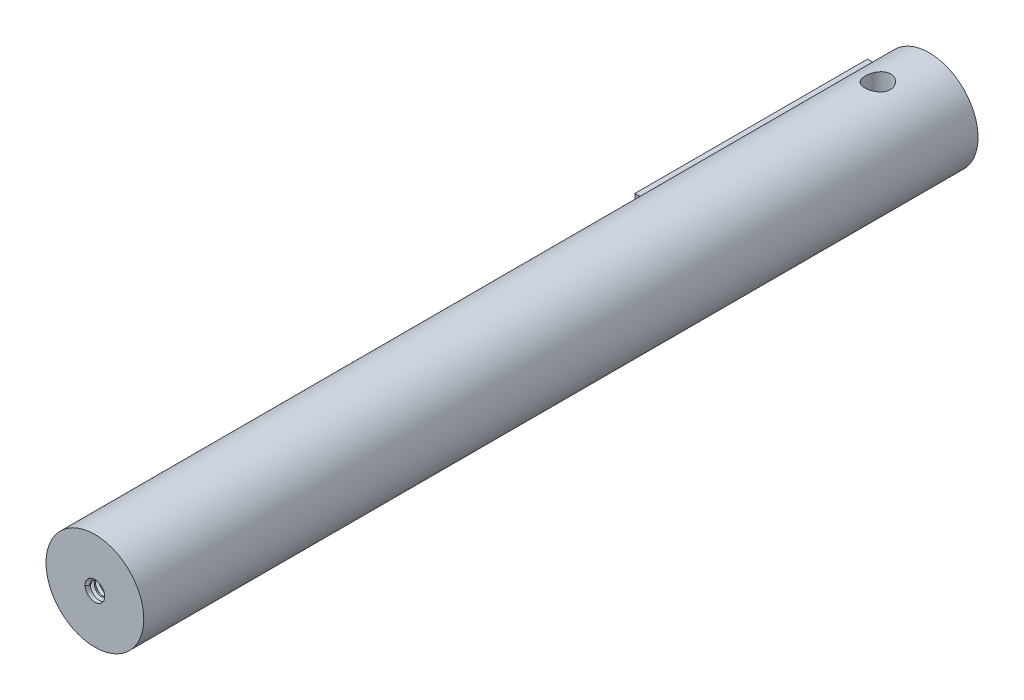
from build123d import *
from build123d.topology import SkipClean

# Parameters (mm, degrees)
BOSS_EXTRUDE4_DEPTH     = 58.928
SKETCH8_R               = 12.3825
BOSS_EXTRUDE5_DEPTH     = 152.4
SKETCH10_R              = 2.487613
CUT_EXTRUDE1_DEPTH      = 12.7
THREAD1_PITCH           = 1.27
CUT_EXTRUDE2_DEPTH      = 213.266198
CUT_EXTRUDE2_DEPTH_BACK = 213.266198
SKETCH11_R              = 3.175


with BuildPart() as part:
    # Sketch1 → Boss-Extrude4 (new body)
    with BuildSketch(Plane.XY):
        with BuildLine():
            Line((0, -2.921), (0, 0))
            Line((0, 0), (0, 3.175))
            Line((0, 3.175), (-11.968529, 3.175))
            ThreePointArc((-11.968529, 3.175), (-12.381807, 0.131032), (-12.033041, -2.921))
            Line((-12.033041, -2.921), (0, -2.921))
        make_face()
        with BuildLine():
            Line((0, 3.175), (0, 0))
            Line((0, 0), (0, -2.921))
            Line((0, -2.921), (-12.033041, -2.921))
            ThreePointArc((-12.033041, -2.921), (1.470915, -12.294825), (12.3825, 0))
            ThreePointArc((12.3825, 0), (1.600937, 12.278571), (-11.968529, 3.175))
            Line((-11.968529, 3.175), (0, 3.175))
        make_face()
        with BuildLine():
            ThreePointArc((-12.033041, -2.921), (-12.381807, 0.131032), (-11.968529, 3.175))
            Line((-11.968529, 3.175), (-15.621, 3.175))
            Line((-15.621, 3.175), (-15.621, -2.921))
            Line((-15.621, -2.921), (-12.033041, -2.921))
        make_face()
    extrude(amount=BOSS_EXTRUDE4_DEPTH)

    # Sketch8 → Boss-Extrude5 (add)
    with BuildSketch(Plane.XY.offset(58.928)):
        with Locations(Location((0, 0, 0), (0, 0, 193.644529))):
            Circle(SKETCH8_R)
    extrude(amount=BOSS_EXTRUDE5_DEPTH)

    # Sketch10 → Cut-Extrude1 (cut)
    with BuildSketch(Plane.XY.offset(211.328)):
        Circle(SKETCH10_R)
    extrude(amount=-CUT_EXTRUDE1_DEPTH, mode=Mode.SUBTRACT)

    # Thread1: the profile of Thread Profile1 profile screwed along a right-hand helix of 10 turns, 8 arcs to a turn; built about Z, then put on its axis
    with SkipClean():  # the faces are left unmerged after this step: merging them gives an invalid solid
        thread1_z = Axis((0, 0, 0), (0, 0, 1))
        thread1_corners = [(2.487913, 0, -0.000173), (2.487913, 0, 1.111423), (1.800205, 0, 0.714375), (1.800205, 0, 0.396875)]
        with BuildLine(mode=Mode.PRIVATE) as thread1_profile:
            Line(thread1_corners[0], thread1_corners[1])
            Line(thread1_corners[1], thread1_corners[2])
            Line(thread1_corners[2], thread1_corners[3])
            Line(thread1_corners[3], thread1_corners[0])
        thread1_cap = Face(thread1_profile.wire())
        thread1_turn_angles = [0, 22.5, 45, 67.5, 90, 112.5, 135, 157.5, 180, 202.5, 225, 247.5, 270, 292.5, 315, 337.5, 360]
        thread1_turn_weights = [1, 0.9238795325112867, 1, 0.9238795325112867, 1, 0.9238795325112867, 1, 0.9238795325112867, 1, 0.9238795325112867, 1, 0.9238795325112867, 1, 0.9238795325112867, 1, 0.9238795325112867, 1]
        thread1_turn_rails = [Edge.make_bspline([Vector(p[0], p[1], 0).rotate(thread1_z, thread1_turn_angles[k]) / thread1_turn_weights[k] + Vector(0, 0, p[2] + THREAD1_PITCH * thread1_turn_angles[k] / 360) for k in range(17)], [0, 0, 0, 1, 1, 2, 2, 3, 3, 4, 4, 5, 5, 6, 6, 7, 7, 8, 8, 8], 2, thread1_turn_weights) for p in thread1_corners]
        thread1_turn_sides = [Face.make_surface_from_curves(thread1_turn_rails[p[0]], thread1_turn_rails[p[1]]) for p in [(0, 1), (1, 2), (2, 3), (3, 0)]]
        thread1 = Plane(origin=(0, 0, 211.328), x_dir=(-1, 0, 0), z_dir=(0, 0, -1)) * Solid(Shell([*[p.moved(Location((0, 0, THREAD1_PITCH * i))) for i in range(10) for p in thread1_turn_sides], thread1_cap, thread1_cap.rotate(thread1_z, 3600).moved(Location((0, 0, THREAD1_PITCH * 3600 / 360)))]))
        add(thread1)

    # Sketch11 → Cut-Extrude2 (cut, two sides: drawn at the far end of the back side and taken through both)
    with BuildSketch(Plane(origin=(0, 0, 0), x_dir=(1, 0, 0), z_dir=(0, 1, 0)).offset(-CUT_EXTRUDE2_DEPTH_BACK)):
        with Locations(Location((-0.3175, -12.7, 0), (0, 0, 270))):
            Circle(SKETCH11_R)
    extrude(amount=CUT_EXTRUDE2_DEPTH + CUT_EXTRUDE2_DEPTH_BACK, mode=Mode.SUBTRACT)


solid = part.part
